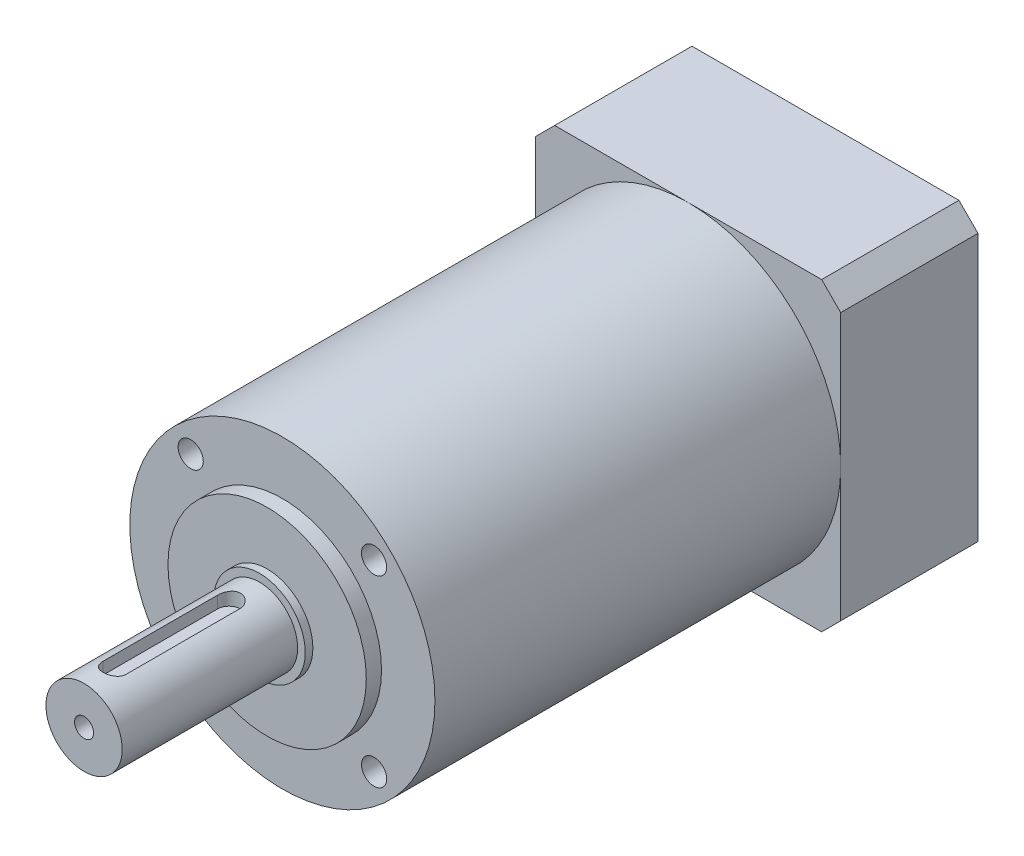
from build123d import *

# Parameters (mm, degrees)
SKETCH_1_W               = 40
SKETCH_1_H               = 40
EXTRUDE_1_DEPTH          = 18
SKETCH_2_R               = 20
EXTRUDE_2_DEPTH          = 53.2
SKETCH_3_R               = 13
EXTRUDE_3_DEPTH          = 2
SKETCH_4_R               = 6
EXTRUDE_4_DEPTH          = 1
SKETCH_5_R               = 5
EXTRUDE_5_DEPTH          = 23
CUT_EXTRUDE_1_DEPTH      = 1.8
HOLE_WIZARD_M31_D        = 2.5
HOLE_WIZARD_M31_DEPTH    = 15
HOLE_WIZARD_M31_TIP      = 0.751075774
PATTERN_CIRCULAR_1_COUNT = 4
CHAMFER_1_SIZE           = 2.5
SKETCH_15_R              = 16.5
CUT_EXTRUDE_2_DEPTH      = 18
EXTRUDE_6_DEPTH          = 15
FILLET_1_R               = 0.5
SKETCH_17_R              = 13.5
SKETCH_17_R_2            = 9
EXTRUDE_7_DEPTH          = 16
FILLET_2_R               = 0.5
PATTERN_CIRCULAR_2_COUNT = 4


with BuildPart() as part:
    # Эскиз1 → Бобышка-Вытянуть1 (new body)
    with BuildSketch(Plane.XY):
        with Locations((20, 20)):
            Rectangle(SKETCH_1_W, SKETCH_1_H)
    extrude(amount=EXTRUDE_1_DEPTH)

    # Эскиз2 → Бобышка-Вытянуть2 (add)
    with BuildSketch(Plane.XY.offset(18)):
        with Locations((20, 20)):
            Circle(SKETCH_2_R)
    extrude(amount=EXTRUDE_2_DEPTH)

    # Эскиз3 → Бобышка-Вытянуть3 (add)
    with BuildSketch(Plane.XY.offset(71.2)):
        with Locations((20, 20)):
            Circle(SKETCH_3_R)
    extrude(amount=EXTRUDE_3_DEPTH)

    # Эскиз4 → Бобышка-Вытянуть4 (add)
    with BuildSketch(Plane.XY.offset(73.2)):
        with Locations((20, 20)):
            Circle(SKETCH_4_R)
    extrude(amount=EXTRUDE_4_DEPTH)

    # Эскиз5 → Бобышка-Вытянуть5 (add)
    with BuildSketch(Plane.XY.offset(74.2)):
        with Locations((20, 20)):
            Circle(SKETCH_5_R)
    extrude(amount=EXTRUDE_5_DEPTH)

    # Эскиз9 → Вырез-Вытянуть1 (cut)
    with BuildSketch(Plane(origin=(0, 25, 0), x_dir=(-1, 0, 0), z_dir=(0, -1, 0))):
        with BuildLine():
            Line((-21.5, -93.2), (-21.5, -78.2))
            ThreePointArc((-21.5, -78.2), (-20, -76.7), (-18.5, -78.2))
            Line((-18.5, -78.2), (-18.5, -93.2))
            ThreePointArc((-18.5, -93.2), (-20, -94.7), (-21.5, -93.2))
        make_face()
    extrude(amount=CUT_EXTRUDE_1_DEPTH, mode=Mode.SUBTRACT)

    # Отверстие обработанное метчиком M31
    with Locations(Plane.XY.offset(97.2)):
        with Locations((20, 20)):
            Hole(HOLE_WIZARD_M31_D / 2, depth=HOLE_WIZARD_M31_DEPTH)
            with Locations((0, 0, -(HOLE_WIZARD_M31_DEPTH + HOLE_WIZARD_M31_TIP / 2))):  # 118° drill point
                Cone(0, HOLE_WIZARD_M31_D / 2, HOLE_WIZARD_M31_TIP, mode=Mode.SUBTRACT)

    # Эскиз14 → Отверстие обработанное метчиком M41 (revolve, cut)
    with BuildSketch(Plane(origin=(7.97918472, 32.02081528, 71.2), x_dir=(0, -1, 0), z_dir=(1, 0, 0))):
        Polygon((0, 0), (0, 7.991420021), (1.65, 7), (1.65, 0), align=None)
    hole_wizard_m41 = revolve(axis=Axis((7.97918472, 32.02081528, 77.55), (0, 0, -1)), mode=Mode.SUBTRACT)

    # Круговой массив1: Отверстие обработанное метчиком M41 ×4 about axis
    pattern_circular_1_axis = Axis((20, 20, 71.2), (0, 0, 1))
    for i in range(1, PATTERN_CIRCULAR_1_COUNT):
        add(hole_wizard_m41.rotate(pattern_circular_1_axis, i * 360 / PATTERN_CIRCULAR_1_COUNT), mode=Mode.SUBTRACT)

    # Фаска1
    chamfer_1_edges = [part.edges().sort_by_distance(p)[0] for p in [
        (0, 0, 9),
        (40, 0, 9),
        (40, 40, 9),
        (0, 40, 9),
    ]]
    chamfer(chamfer_1_edges, length=CHAMFER_1_SIZE)

    # Эскиз15 → Вырез-Вытянуть2 (cut)
    with BuildSketch(Plane(origin=(0, 0, 0), x_dir=(-1, 0, 0), z_dir=(0, 0, -1))):
        with Locations((-20, 20)):
            Circle(SKETCH_15_R)
    extrude(amount=-CUT_EXTRUDE_2_DEPTH, mode=Mode.SUBTRACT)

    # Эскиз16 → Бобышка-Вытянуть6 (add)
    with BuildSketch(Plane(origin=(0, 0, 18), x_dir=(-1, 0, 0), z_dir=(0, 0, -1))):
        with BuildLine():
            Line((-21, 14.591673087), (-21, 11.05572809))
            ThreePointArc((-21, 11.05572809), (-20, 29), (-19, 11.05572809))
            Line((-19, 11.05572809), (-19, 14.591673087))
            ThreePointArc((-19, 14.591673087), (-20, 25.5), (-21, 14.591673087))
        make_face()
    extrude(amount=EXTRUDE_6_DEPTH)

    # Скругление1
    fillet_1_edges = [part.edges().sort_by_distance(p)[0] for p in [
        (20, 25.5, 3),
        (20, 29, 3),
    ]]
    fillet(fillet_1_edges, radius=FILLET_1_R)

    # Эскиз17 → Бобышка-Вытянуть7 (add)
    with BuildSketch(Plane(origin=(0, 0, 18), x_dir=(-1, 0, 0), z_dir=(0, 0, -1))):
        with Locations((-20, 20)):
            Circle(SKETCH_17_R)
        with Locations((-20, 20)):
            Circle(SKETCH_17_R_2, mode=Mode.SUBTRACT)
    extrude(amount=EXTRUDE_7_DEPTH)

    # Скругление2
    fillet_2_edges = [part.edges().sort_by_distance(p)[0] for p in [
        (29, 20, 2),
    ]]
    fillet(fillet_2_edges, radius=FILLET_2_R)

    # Эскиз22 → Отверстие обработанное метчиком M43 (revolve, cut)
    with BuildSketch(Plane(origin=(36.3, 36.3, 0), x_dir=(0, 1, 0), z_dir=(1, 0, 0))):
        Polygon((0, 0), (0, 12.491420021), (1.65, 11.5), (1.65, 0), align=None)
    hole_wizard_m43 = revolve(axis=Axis((36.3, 36.3, -6.35), (0, 0, 1)), mode=Mode.SUBTRACT)

    # Круговой массив2: Отверстие обработанное метчиком M43 ×4 about axis
    pattern_circular_2_axis = Axis((20, 20, 18), (0, 0, -1))
    for i in range(1, PATTERN_CIRCULAR_2_COUNT):
        add(hole_wizard_m43.rotate(pattern_circular_2_axis, i * 360 / PATTERN_CIRCULAR_2_COUNT), mode=Mode.SUBTRACT)


solid = part.part
